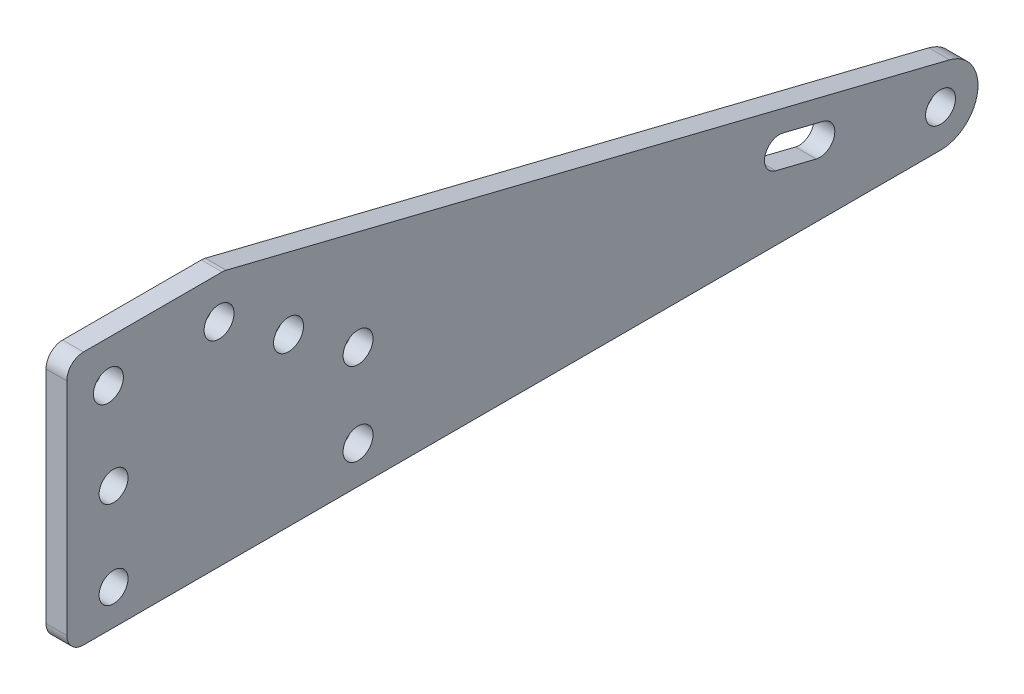
from build123d import *

# Parameters (mm, degrees)
SKETCH1_R           = 2.286
BOSS_EXTRUDE1_DEPTH = 3.175
SKETCH2_R           = 2.20991013
CUT_EXTRUDE1_DEPTH  = 99.353280322


with BuildPart() as part:
    # Sketch1 → Boss-Extrude1 (new body)
    with BuildSketch(Plane(origin=(0, 0, 0), x_dir=(0, 0, -1), z_dir=(1, 0, 0))):
        with BuildLine():
            Line((-20.135783276, 26.595233027), (90.276415546, -0.80322569))
            ThreePointArc((90.276415546, -0.80322569), (94.572787682, -7.043328861), (88.9, -12.065))
            Line((88.9, -12.065), (0, -12.065))
            Line((0, -12.065), (-41.91, -12.065))
            ThreePointArc((-41.91, -12.065), (-43.706051224, -11.321051224), (-44.45, -9.525))
            Line((-44.45, -9.525), (-44.45, 24.13))
            ThreePointArc((-44.45, 24.13), (-43.706051224, 25.926051224), (-41.91, 26.67))
            Line((-41.91, 26.67), (-20.747523518, 26.67))
            ThreePointArc((-20.747523518, 26.67), (-20.439377358, 26.65123897), (-20.135783276, 26.595233027))
        make_face()
        with Locations((0, 6.35)):
            Circle(SKETCH1_R, mode=Mode.SUBTRACT)
        with Locations((0, -6.35)):
            Circle(SKETCH1_R, mode=Mode.SUBTRACT)
        with Locations((88.9, -6.35)):
            Circle(SKETCH1_R, mode=Mode.SUBTRACT)
        with Locations((-21.213182222, 20.32)):
            Circle(SKETCH1_R, mode=Mode.SUBTRACT)
        with Locations((-10.606591111, 13.335)):
            Circle(SKETCH1_R, mode=Mode.SUBTRACT)
        with Locations((-38.1, 20.32)):
            Circle(SKETCH1_R, mode=Mode.SUBTRACT)
    extrude(amount=BOSS_EXTRUDE1_DEPTH)

    # Sketch2 → Cut-Extrude1 (cut, through all)
    with BuildSketch(Plane(origin=(3.175, 0, 0), x_dir=(0, 0, -1), z_dir=(1, 0, 0))):
        with Locations((-37.310316922, 6.68008987)):
            Circle(SKETCH2_R)
        with Locations((-37.310316922, -6.68008987)):
            Circle(SKETCH2_R)
        with BuildLine():
            Line((64.861053538, 2.232227609), (71.024136105, 0.702877002))
            ThreePointArc((71.024136105, 0.702877002), (72.69227961, -2.06639894), (69.923003668, -3.734542446))
            Line((69.923003668, -3.734542446), (63.759921102, -2.205191839))
            ThreePointArc((63.759921102, -2.205191839), (62.091777596, 0.564084103), (64.861053538, 2.232227609))
        make_face()
    extrude(amount=-CUT_EXTRUDE1_DEPTH, mode=Mode.SUBTRACT)


solid = part.part
